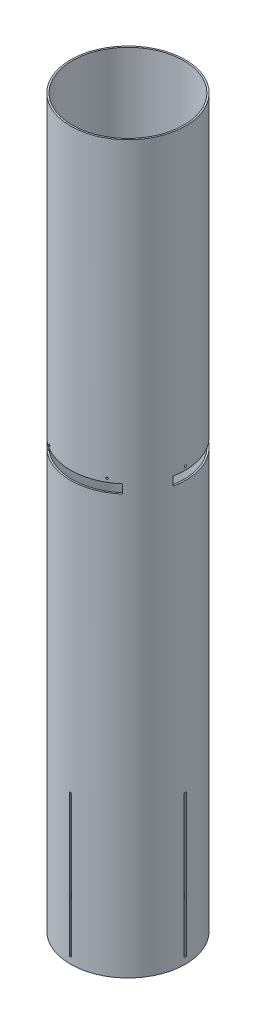
from build123d import *

# Parameters (mm, degrees)
SKETCH1_R           = 78.359
SKETCH1_R_2         = 76.2
BOSS_EXTRUDE1_DEPTH = 990.6
CUT_EXTRUDE1_DEPTH  = 997.779125866
CIRPATTERN1_COUNT   = 4
CUT_EXTRUDE2_DEPTH  = 997.779125866
CIRPATTERN2_COUNT   = 6
SKETCH3_R           = 3.175
CUT_EXTRUDE3_DEPTH  = 997.779125981
CUT_EXTRUDE4_START  = -12.065
CUT_EXTRUDE4_DEPTH  = 12.065
CIRPATTERN3_COUNT   = 3


with BuildPart() as part:
    # Sketch1 → Boss-Extrude1 (new body)
    with BuildSketch(Plane(origin=(0, 0, 0), x_dir=(1, 0, 0), z_dir=(0, 1, 0))):
        Circle(SKETCH1_R)
        Circle(SKETCH1_R_2, mode=Mode.SUBTRACT)
    extrude(amount=BOSS_EXTRUDE1_DEPTH)

    # Sketch2 → Cut-Extrude1 (cut, through all)
    with BuildSketch(Plane(origin=(0, 0, 0), x_dir=(0, 0, -1), z_dir=(1, 0, 0))):
        Polygon((0, 8.89), (1.5875, 8.89), (1.5875, 203.2), (-1.5875, 203.2), (-1.5875, 8.89), align=None)
    cut_extrude1 = extrude(amount=-CUT_EXTRUDE1_DEPTH, mode=Mode.SUBTRACT)

    # CirPattern1: Cut-Extrude1 ×4 about axis
    cirpattern1_axis = Axis((0, 0, 0), (0, 1, 0))
    for i in range(1, CIRPATTERN1_COUNT):
        add(cut_extrude1.rotate(cirpattern1_axis, i * 360 / CIRPATTERN1_COUNT), mode=Mode.SUBTRACT)

    # Sketch2<3> → Cut-Extrude2 (cut, through all)
    with BuildSketch(Plane(origin=(0, 0, 0), x_dir=(0, 0, -1), z_dir=(1, 0, 0))):
        with BuildLine():
            ThreePointArc((0, 589.99755), (-0.956397277, 587.688602723), (1.35255, 588.645))
            ThreePointArc((1.35255, 588.645), (0.956397277, 589.601397277), (0, 589.99755))
        make_face()
    cut_extrude2 = extrude(amount=-CUT_EXTRUDE2_DEPTH, mode=Mode.SUBTRACT)

    # CirPattern2: Cut-Extrude2 ×6 about axis
    cirpattern2_axis = Axis((0, 990.6, 0), (0, -1, 0))
    for i in range(1, CIRPATTERN2_COUNT):
        add(cut_extrude2.rotate(cirpattern2_axis, i * 360 / CIRPATTERN2_COUNT), mode=Mode.SUBTRACT)

    # Sketch3 → Cut-Extrude3 (cut, through all)
    with BuildSketch(Plane(origin=(0, 0, 0), x_dir=(0.7071067811865477, 0, -0.7071067811865475), z_dir=(0.7071067811865475, 0, 0.7071067811865477))):
        with Locations((0, 127)):
            Circle(SKETCH3_R)
    extrude(amount=-CUT_EXTRUDE3_DEPTH, mode=Mode.SUBTRACT)

    # Sketch7 → Cut-Extrude4 (cut)
    with BuildSketch(Plane(origin=(0, 583.8825, 0), x_dir=(1, 0, 0), z_dir=(0, 1, 0)).offset(CUT_EXTRUDE4_START)):
        with BuildLine():
            Line((-76.853353787, -15.287082543), (-74.735838367, -14.865882538))
            ThreePointArc((-74.735838367, -14.865882538), (-65.991135768, 38.1), (-24.493687256, 72.156075868))
            Line((-24.493687256, 72.156075868), (-25.187675062, 74.200498017))
            ThreePointArc((-25.187675062, 74.200498017), (-31.722088262, 71.650833891), (-38.002320334, 68.527049624))
            ThreePointArc((-38.002320334, 68.527049624), (-39.1795, 67.860884615), (-40.345005654, 67.174499624))
            ThreePointArc((-40.345005654, 67.174499624), (-67.860884615, 39.1795), (-78.347325988, 1.35255))
            ThreePointArc((-78.347325988, 1.35255), (-78.359, 0), (-78.347325988, -1.35255))
            ThreePointArc((-78.347325988, -1.35255), (-77.912486483, -8.35328265), (-76.853353787, -15.287082543))
        make_face()
    cut_extrude4 = extrude(amount=CUT_EXTRUDE4_DEPTH, mode=Mode.SUBTRACT)

    # CirPattern3: Cut-Extrude4 ×3 about axis
    cirpattern3_axis = Axis((0, 990.6, 0), (0, -1, 0))
    for i in range(1, CIRPATTERN3_COUNT):
        add(cut_extrude4.rotate(cirpattern3_axis, i * 360 / CIRPATTERN3_COUNT), mode=Mode.SUBTRACT)


solid = part.part
